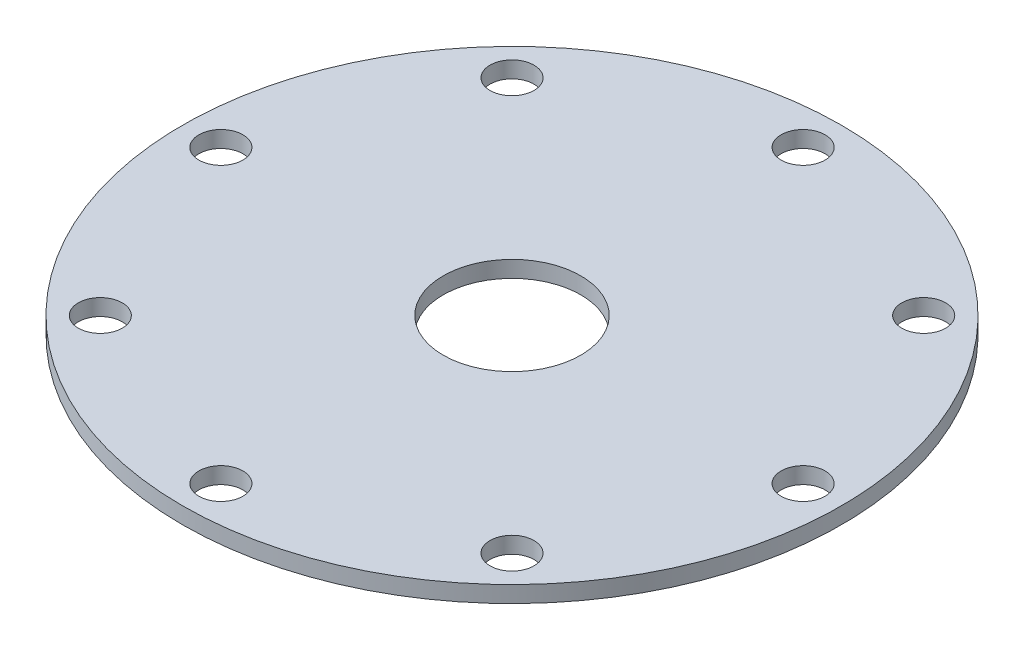
from build123d import *

# Parameters (mm, degrees)
SKETCH_1_R      = 30
SKETCH_1_R_2    = 2
SKETCH_1_R_3    = 6.260668566
EXTRUDE_1_DEPTH = 1.5


with BuildPart() as part:
    # 草图1 → 凸台-拉伸1 (new body)
    with BuildSketch(Plane(origin=(0, 0, 0), x_dir=(1, 0, 0), z_dir=(0, 1, 0))):
        Circle(SKETCH_1_R)
        with Locations((0, 26.5)):
            Circle(SKETCH_1_R_2, mode=Mode.SUBTRACT)
        with Locations((18.738329701, 18.738329701)):
            Circle(SKETCH_1_R_2, mode=Mode.SUBTRACT)
        with Locations((26.5, 0)):
            Circle(SKETCH_1_R_2, mode=Mode.SUBTRACT)
        with Locations((18.738329701, -18.738329701)):
            Circle(SKETCH_1_R_2, mode=Mode.SUBTRACT)
        with Locations((0, -26.5)):
            Circle(SKETCH_1_R_2, mode=Mode.SUBTRACT)
        with Locations((-18.738329701, -18.738329701)):
            Circle(SKETCH_1_R_2, mode=Mode.SUBTRACT)
        with Locations((-26.5, 0)):
            Circle(SKETCH_1_R_2, mode=Mode.SUBTRACT)
        with Locations((-18.738329701, 18.738329701)):
            Circle(SKETCH_1_R_2, mode=Mode.SUBTRACT)
        Circle(SKETCH_1_R_3, mode=Mode.SUBTRACT)
    extrude(amount=EXTRUDE_1_DEPTH)


solid = part.part
